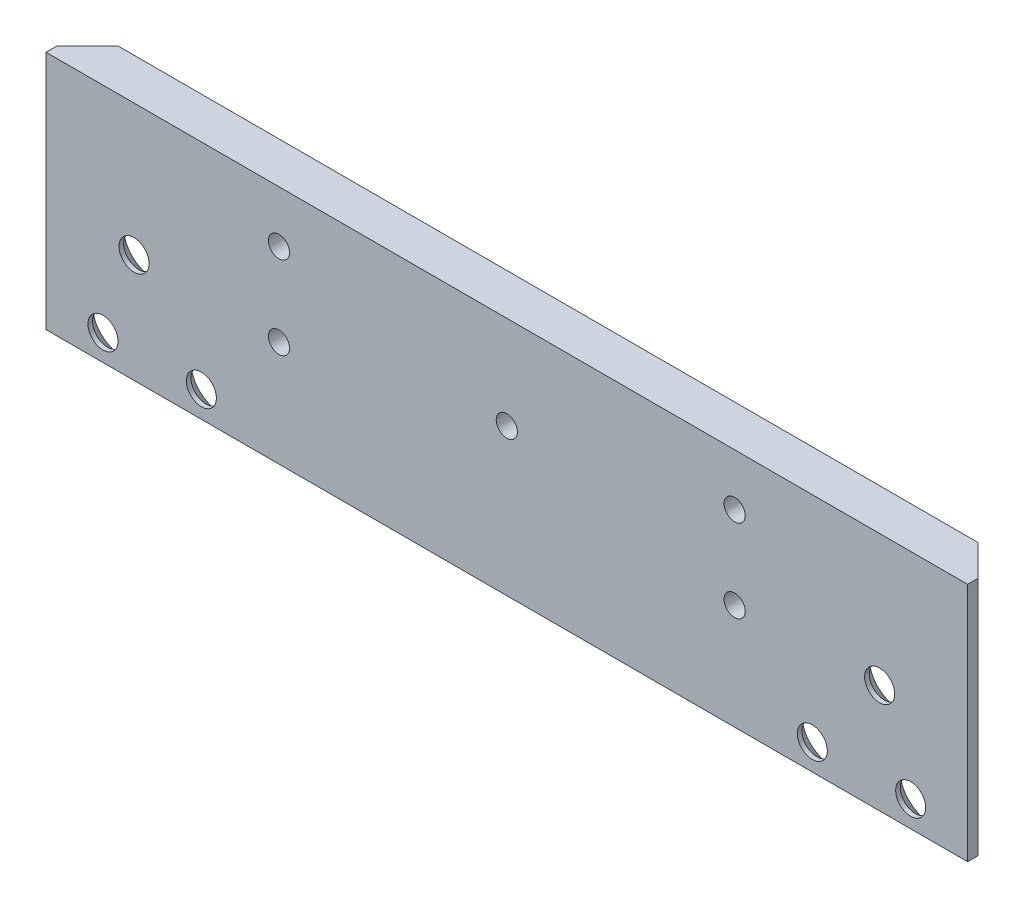
from build123d import *

# Parameters (mm, degrees)
SKETCH1_W                                      = 94
SKETCH1_H                                      = 23.2
BOSS_EXTRUDE1_DEPTH                            = 4
CHAMFER1_SIZE                                  = 5.5
CUT_EXTRUDE2_DEPTH                             = 48.12547082
CUT_EXTRUDE2_DEPTH_BACK                        = 48.12547082
SKETCH9_W                                      = 30.391833943
SKETCH9_H                                      = 23.2
SHELL1_START                                   = -9.1
SHELL1_DEPTH                                   = 18.2
FILLET1_R                                      = 1
M2_5X0_45_TAPPED_HOLE1_D                       = 2.05
M2_5X0_45_TAPPED_HOLE1_DEPTH                   = 6
M2_5X0_45_TAPPED_HOLE1_CSINK_D                 = 2.55
M2_5X0_45_TAPPED_HOLE1_CSINK_ANGLE             = 90
M2_5X0_45_TAPPED_HOLE1_TIP                     = 0.615882135
CSK_FOR_M2_5_FLAT_HEAD_MACHINE_SCREW1_AT_COUNT = 2
CSK_FOR_M2_5_FLAT_HEAD_MACHINE_SCREW1_AT_PITCH = 8.544003745
CSK_FOR_M2_5_FLAT_HEAD_MACHINE_SCREW_2_COUNT   = 2
CSK_FOR_M2_5_FLAT_HEAD_MACHINE_SCREW_2_PITCH   = 10.307764064
SKETCH8_W                                      = 19.75
SKETCH8_H                                      = 5.25
CUT_EXTRUDE1_DEPTH                             = 47.042073151
FILLET5_R                                      = 1
FILLET5_OF_MIRROR1_R                           = 1


# Read off the part's stored shape, not the designer's step: Shell1
with BuildPart() as part:
    # Sketch1 → Boss-Extrude1 (new body)
    with BuildSketch(Plane.XY):
        Rectangle(SKETCH1_W, SKETCH1_H)
    extrude(amount=BOSS_EXTRUDE1_DEPTH)

    # Chamfer1
    # the kernel refuses this chamfer: 5.5 mm, written as the material it takes off along each edge
    with BuildSketch(Plane(origin=(47, 25.744256434, 0), x_dir=(0.027495876610585942, 0, 0.9996219169112968), z_dir=(0, -1, 0)), Plane(origin=(-47, -25.744256434, 0), x_dir=(-0.027495876610585942, 0, 0.9996219169112968), z_dir=(0, 1, 0))) as chamfer1_piece_1:
        Polygon((CHAMFER1_SIZE * 0.999621916911, CHAMFER1_SIZE * 0.0274958766106), (-CHAMFER1_SIZE * 0.0274958766106, CHAMFER1_SIZE * 0.999621916911), (0, 0), align=None)
    extrude(amount=51.488512868, mode=Mode.SUBTRACT)

    # Sketch9 → Cut-Extrude2 (cut, two sides: drawn at the far end of the back side and taken through both)
    with BuildSketch(Plane(origin=(0, 0, 0), x_dir=(-1, 0, 0), z_dir=(0, 0, -1)).offset(-CUT_EXTRUDE2_DEPTH_BACK)):
        with Locations((-59.695916972, 0)):
            Rectangle(SKETCH9_W, SKETCH9_H)
        with Locations((59.695916972, 0)):
            Rectangle(SKETCH9_W, SKETCH9_H)
    extrude(amount=CUT_EXTRUDE2_DEPTH + CUT_EXTRUDE2_DEPTH_BACK, mode=Mode.SUBTRACT)

    # Shell1 outline → Shell1 (cut)
    with BuildSketch(Plane(origin=(0, 0, 0), x_dir=(1, 0, 0), z_dir=(0, 1, 0)).offset(SHELL1_START)):
        Polygon((-41.5, 0), (-43.75, -2.25), (43.75, -2.25), (41.5, 0), align=None)
    extrude(amount=SHELL1_DEPTH, mode=Mode.SUBTRACT)

    # Fillet1
    fillet1_edges = [part.edges().sort_by_distance(p)[0] for p in [
        (0, 9.1, 2.25),
        (0, -9.1, 2.25),
    ]]
    fillet(fillet1_edges, radius=FILLET1_R)

    # M2.5x0.45 Tapped Hole1
    with Locations(Plane(origin=(0, 0, 2.25), x_dir=(-1, 0, 0), z_dir=(0, 0, -1))):
        with Locations((0, 2.6), (-22, 6.6), (-22, -1.4), (22, -1.4), (22, 6.6)):
            CounterSinkHole(M2_5X0_45_TAPPED_HOLE1_D / 2, M2_5X0_45_TAPPED_HOLE1_CSINK_D / 2, depth=M2_5X0_45_TAPPED_HOLE1_DEPTH, counter_sink_angle=M2_5X0_45_TAPPED_HOLE1_CSINK_ANGLE)
            with Locations((0, 0, -(M2_5X0_45_TAPPED_HOLE1_DEPTH + M2_5X0_45_TAPPED_HOLE1_TIP / 2))):  # 118° drill point
                Cone(0, M2_5X0_45_TAPPED_HOLE1_D / 2, M2_5X0_45_TAPPED_HOLE1_TIP, mode=Mode.SUBTRACT)

    # Sketch5 → CSK for M2.5 Flat Head Machine Screw1 (revolve, cut)
    with BuildSketch(Plane(origin=(36, -1.1, 2.25), x_dir=(0, 1, 0), z_dir=(1, 0, 0))):
        Polygon((0, 0), (0, 7.321247898), (1.45, 6.45), (1.45, 1.3), (2.75, 0), align=None)
    csk_for_m2_5_flat_head_machine_screw1 = revolve(axis=Axis((36, -1.1, -4.1), (0, 0, 1)), mode=Mode.SUBTRACT)

    # CSK for M2.5 Flat Head Machine Screw1 at: CSK for M2.5 Flat Head Machine Screw1 ×2
    with Locations(*[Vector(0.35112344158839104, -0.9363291775690448, 0) * (i * CSK_FOR_M2_5_FLAT_HEAD_MACHINE_SCREW1_AT_PITCH) for i in range(1, CSK_FOR_M2_5_FLAT_HEAD_MACHINE_SCREW1_AT_COUNT)]):
        add(csk_for_m2_5_flat_head_machine_screw1, mode=Mode.SUBTRACT)

    # CSK for M2.5 Flat Head Machine Screw 2: CSK for M2.5 Flat Head Machine Screw1 ×2
    with Locations(*[Vector(-0.6305926250944661, -0.7761140001162652, 0) * (i * CSK_FOR_M2_5_FLAT_HEAD_MACHINE_SCREW_2_PITCH) for i in range(1, CSK_FOR_M2_5_FLAT_HEAD_MACHINE_SCREW_2_COUNT)]):
        add(csk_for_m2_5_flat_head_machine_screw1, mode=Mode.SUBTRACT)

    # Sketch8 → Cut-Extrude1 (cut, through all)
    with BuildSketch(Plane(origin=(0, 0, 2.25), x_dir=(-1, 0, 0), z_dir=(0, 0, -1))):
        with Locations((-34.625, -8.975)):
            Rectangle(SKETCH8_W, SKETCH8_H)
    cut_extrude1 = extrude(amount=CUT_EXTRUDE1_DEPTH, mode=Mode.SUBTRACT)

    # Fillet5
    fillet5_edges = [part.edges().sort_by_distance(p)[0] for p in [
        (24.75, -9.85, 2.25),
    ]]
    fillet(fillet5_edges, radius=FILLET5_R)

    # Mirror1: CSK for M2.5 Flat Head Machine Screw1, Cut-Extrude1 across plane
    add(csk_for_m2_5_flat_head_machine_screw1.mirror(Plane(origin=(0, 0, 0), x_dir=(0, 0, 1), z_dir=(1, 0, 0))), mode=Mode.SUBTRACT)
    add(cut_extrude1.mirror(Plane(origin=(0, 0, 0), x_dir=(0, 0, 1), z_dir=(1, 0, 0))), mode=Mode.SUBTRACT)

    # Mirror1 copy 1 sketch → Mirror1 copy 1 (revolve, cut)
    with BuildSketch(Plane(origin=(-39, -9.1, 2.25), x_dir=(0, 1, 0), z_dir=(-1, 0, 0))):
        Polygon((0, 0), (0, -7.321247898), (1.45, -6.45), (1.45, -1.3), (2.75, 0), align=None)
    revolve(axis=Axis((-39, -9.1, -4.1), (0, 0, -1)), mode=Mode.SUBTRACT)

    # Mirror1 copy 2 sketch → Mirror1 copy 2 (revolve, cut)
    with BuildSketch(Plane(origin=(-29.5, -9.1, 2.25), x_dir=(0, 1, 0), z_dir=(-1, 0, 0))):
        Polygon((0, 0), (0, -7.321247898), (1.45, -6.45), (1.45, -1.3), (2.75, 0), align=None)
    revolve(axis=Axis((-29.5, -9.1, -4.1), (0, 0, -1)), mode=Mode.SUBTRACT)

    # Fillet5 of Mirror1
    fillet5_of_mirror1_edges = [part.edges().sort_by_distance(p)[0] for p in [
        (-24.75, -9.85, 2.25),
    ]]
    fillet(fillet5_of_mirror1_edges, radius=FILLET5_OF_MIRROR1_R)


solid = part.part
